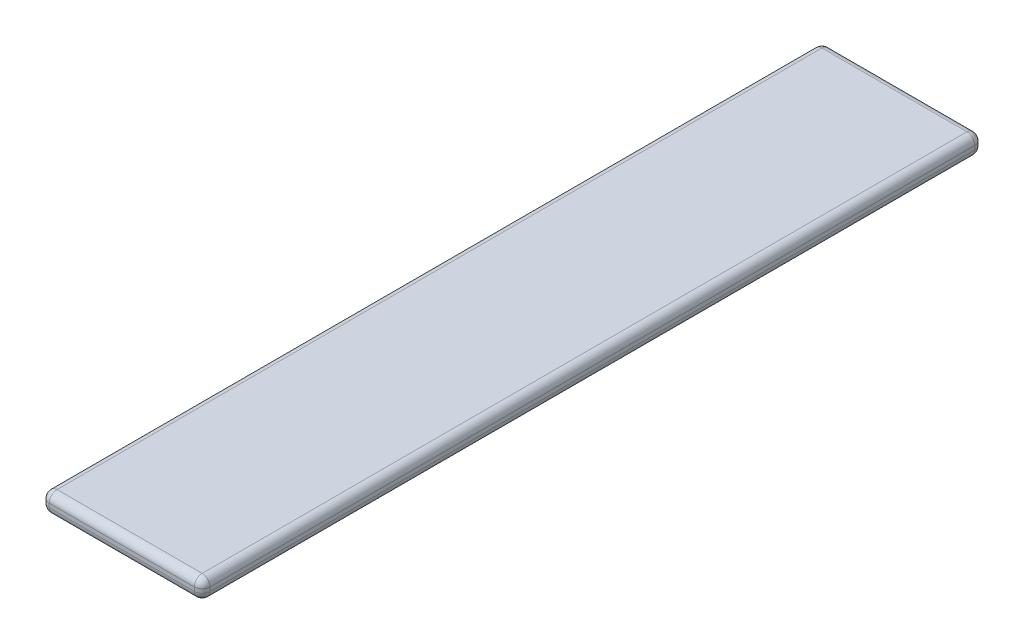
from build123d import *

# Parameters (mm, degrees)
SKETCH1_W           = 410
SKETCH1_H           = 50
BOSS_EXTRUDE1_DEPTH = 1990
FILLET1_R           = 20


with BuildPart() as part:
    # Sketch1 → Boss-Extrude1 (new body)
    with BuildSketch(Plane.XY):
        Rectangle(SKETCH1_W, SKETCH1_H)
    extrude(amount=BOSS_EXTRUDE1_DEPTH)

    # Fillet1
    fillet1_edges = [part.edges().sort_by_distance(p)[0] for p in [
        (-205, -25, 995),
        (205, -25, 995),
        (205, 25, 995),
        (-205, 25, 995),
        (0, 25, 1990),
        (205, 0, 1990),
        (0, -25, 1990),
        (-205, 0, 1990),
        (0, 25, 0),
        (205, 0, 0),
        (0, -25, 0),
        (-205, 0, 0),
    ]]
    fillet(fillet1_edges, radius=FILLET1_R)


solid = part.part
